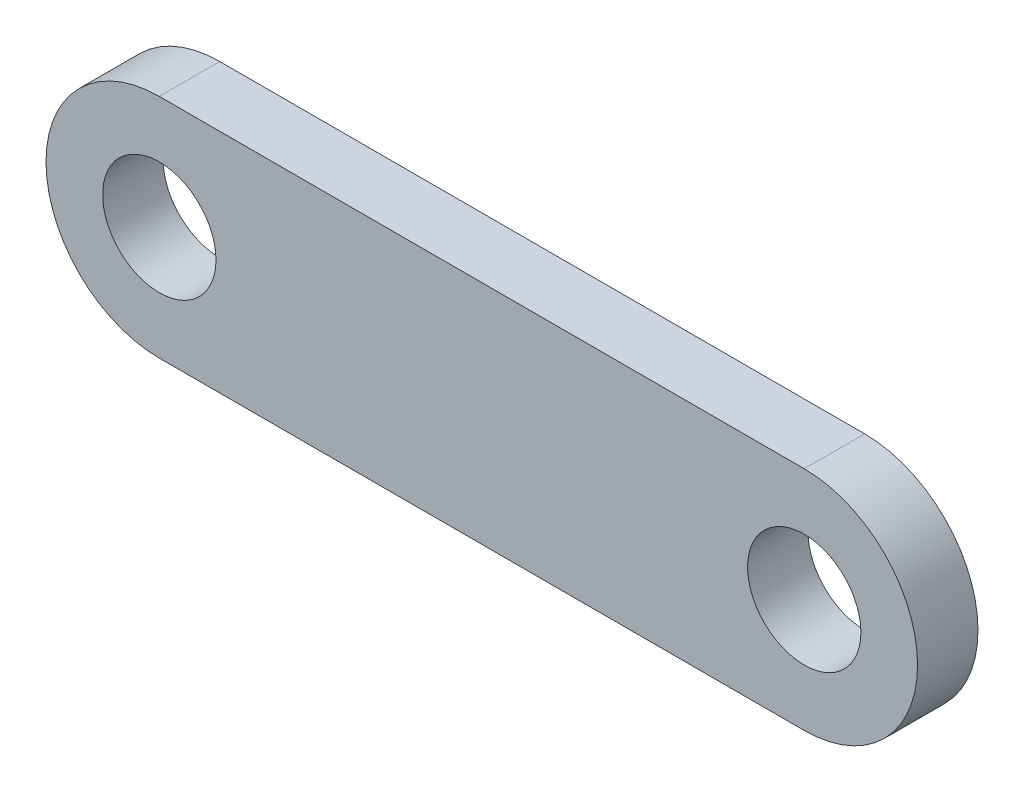
from build123d import *

# Parameters (mm, degrees)
SKETCH1_R           = 2.38125
BOSS_EXTRUDE2_DEPTH = 2.54


with BuildPart() as part:
    # Sketch1 → Boss-Extrude2 (new body)
    with BuildSketch(Plane.XY):
        with BuildLine():
            Line((27.1018, 4.7625), (0, 4.7625))
            ThreePointArc((0, 4.7625), (-4.7625, 0), (0, -4.7625))
            Line((0, -4.7625), (27.1018, -4.7625))
            ThreePointArc((27.1018, -4.7625), (31.8643, 0), (27.1018, 4.7625))
        make_face()
        with Locations((27.1018, 0)):
            Circle(SKETCH1_R, mode=Mode.SUBTRACT)
        Circle(SKETCH1_R, mode=Mode.SUBTRACT)
    extrude(amount=BOSS_EXTRUDE2_DEPTH)


solid = part.part
